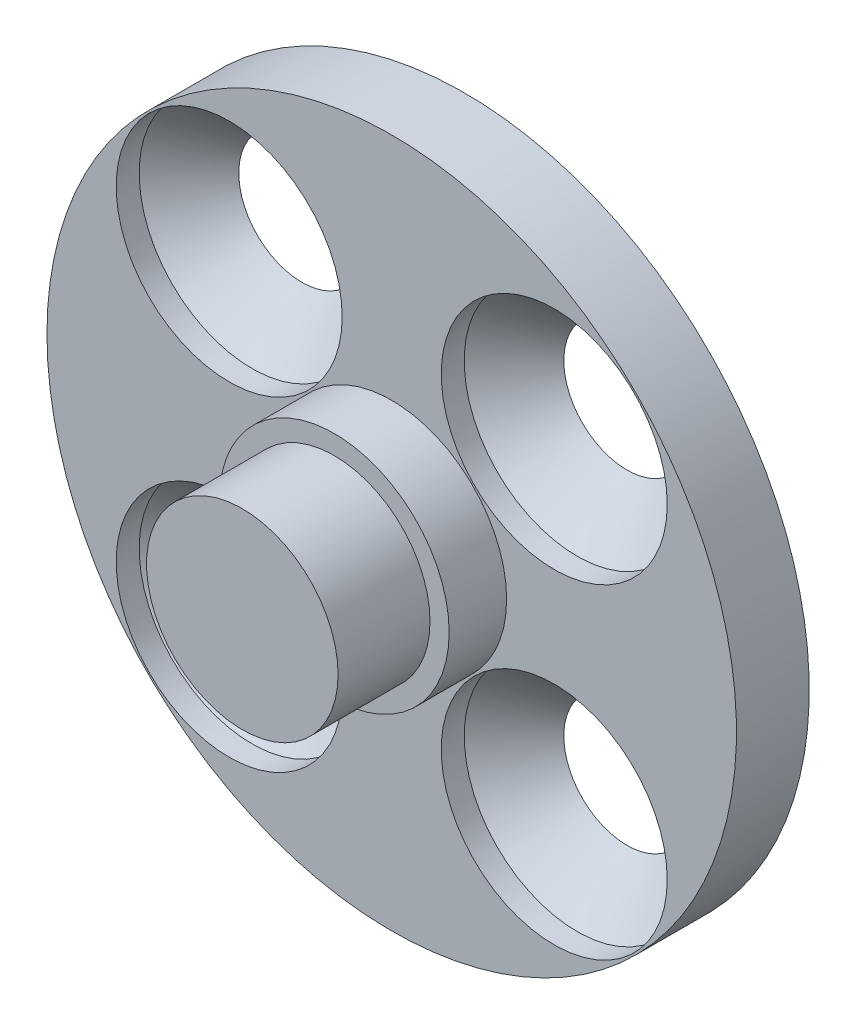
from build123d import *

# Parameters (mm, degrees)
SKETCH1_R           = 9
SKETCH1_R_2         = 1.55
BOSS_EXTRUDE1_DEPTH = 1.9
SKETCH2_R           = 3
BOSS_EXTRUDE2_DEPTH = 1.5
SKETCH3_R           = 2.5
BOSS_EXTRUDE3_DEPTH = 2.4
SKETCH4_R           = 2.95
CUT_EXTRUDE1_DEPTH  = 0.6
CHAMFER1_SIZE       = 1.4


with BuildPart() as part:
    # Sketch1 → Boss-Extrude1 (new body)
    with BuildSketch(Plane(origin=(0, 0, 0), x_dir=(0, 1, 0), z_dir=(0, 0, 1))):
        with Locations(Location((0, 0, 0), (0, 0, 90))):
            Circle(SKETCH1_R)
        with Locations(Location((-4.242640687, 4.242640687, 0), (0, 0, 90))):
            Circle(SKETCH1_R_2, mode=Mode.SUBTRACT)
        with Locations(Location((4.242640687, 4.242640687, 0), (0, 0, 90))):
            Circle(SKETCH1_R_2, mode=Mode.SUBTRACT)
        with Locations(Location((4.242640687, -4.242640687, 0), (0, 0, 90))):
            Circle(SKETCH1_R_2, mode=Mode.SUBTRACT)
        with Locations(Location((-4.242640687, -4.242640687, 0), (0, 0, 90))):
            Circle(SKETCH1_R_2, mode=Mode.SUBTRACT)
    extrude(amount=BOSS_EXTRUDE1_DEPTH)

    # Sketch2 → Boss-Extrude2 (add)
    with BuildSketch(Plane.XY.offset(1.9)):
        Circle(SKETCH2_R)
    extrude(amount=BOSS_EXTRUDE2_DEPTH)

    # Sketch3 → Boss-Extrude3 (add)
    with BuildSketch(Plane.XY.offset(3.4)):
        Circle(SKETCH3_R)
    extrude(amount=BOSS_EXTRUDE3_DEPTH)

    # Sketch4 → Cut-Extrude1 (cut)
    with BuildSketch(Plane.XY.offset(1.9)):
        with Locations((-4.242640687, 4.242640687)):
            Circle(SKETCH4_R)
        with Locations((4.242640687, 4.242640687)):
            Circle(SKETCH4_R)
        with Locations((4.242640687, -4.242640687)):
            Circle(SKETCH4_R)
        with Locations((-4.242640687, -4.242640687)):
            Circle(SKETCH4_R)
    extrude(amount=-CUT_EXTRUDE1_DEPTH, mode=Mode.SUBTRACT)

    # Chamfer1
    # the kernel refuses this chamfer: 1.4 mm, written as the material it takes off along each edge
    with BuildSketch(Plane(origin=(-4.242640687, -4.242640687, 1.3), x_dir=(-1, 0, 0), z_dir=(0, -1, 0))) as chamfer1_piece_1_section:
        Polygon((1.55, CHAMFER1_SIZE), (1.55 + CHAMFER1_SIZE, 0), (1.55, 0), align=None)
    chamfer1_piece_1 = revolve(axis=Axis((-4.242640687, -4.242640687, 1.3), (0, 0, -1)), mode=Mode.PRIVATE)
    chamfer1_piece_1 = chamfer1_piece_1 & Plane(origin=(-4.242640687, -4.242640687, 0.597078296), x_dir=(1, 0, 0), z_dir=(0, 0, 1)) * Cylinder(2.95, 12, mode=Mode.PRIVATE)
    add(chamfer1_piece_1, mode=Mode.SUBTRACT)
    with BuildSketch(Plane(origin=(4.242640687, -4.242640687, 1.3), x_dir=(-1, 0, 0), z_dir=(0, -1, 0))) as chamfer1_piece_2_section:
        Polygon((1.55, CHAMFER1_SIZE), (1.55 + CHAMFER1_SIZE, 0), (1.55, 0), align=None)
    chamfer1_piece_2 = revolve(axis=Axis((4.242640687, -4.242640687, 1.3), (0, 0, -1)), mode=Mode.PRIVATE)
    chamfer1_piece_2 = chamfer1_piece_2 & Plane(origin=(4.242640687, -4.242640687, 0.597078296), x_dir=(1, 0, 0), z_dir=(0, 0, 1)) * Cylinder(2.95, 12, mode=Mode.PRIVATE)
    add(chamfer1_piece_2, mode=Mode.SUBTRACT)
    with BuildSketch(Plane(origin=(4.242640687, 4.242640687, 1.3), x_dir=(-1, 0, 0), z_dir=(0, -1, 0))) as chamfer1_piece_3_section:
        Polygon((1.55, CHAMFER1_SIZE), (1.55 + CHAMFER1_SIZE, 0), (1.55, 0), align=None)
    chamfer1_piece_3 = revolve(axis=Axis((4.242640687, 4.242640687, 1.3), (0, 0, -1)), mode=Mode.PRIVATE)
    chamfer1_piece_3 = chamfer1_piece_3 & Plane(origin=(4.242640687, 4.242640687, 0.597078296), x_dir=(1, 0, 0), z_dir=(0, 0, 1)) * Cylinder(2.95, 12, mode=Mode.PRIVATE)
    add(chamfer1_piece_3, mode=Mode.SUBTRACT)
    with BuildSketch(Plane(origin=(-4.242640687, 4.242640687, 1.3), x_dir=(-1, 0, 0), z_dir=(0, -1, 0))) as chamfer1_piece_4_section:
        Polygon((1.55, CHAMFER1_SIZE), (1.55 + CHAMFER1_SIZE, 0), (1.55, 0), align=None)
    chamfer1_piece_4 = revolve(axis=Axis((-4.242640687, 4.242640687, 1.3), (0, 0, -1)), mode=Mode.PRIVATE)
    chamfer1_piece_4 = chamfer1_piece_4 & Plane(origin=(-4.242640687, 4.242640687, 0.597078296), x_dir=(1, 0, 0), z_dir=(0, 0, 1)) * Cylinder(2.95, 12, mode=Mode.PRIVATE)
    add(chamfer1_piece_4, mode=Mode.SUBTRACT)


solid = part.part
